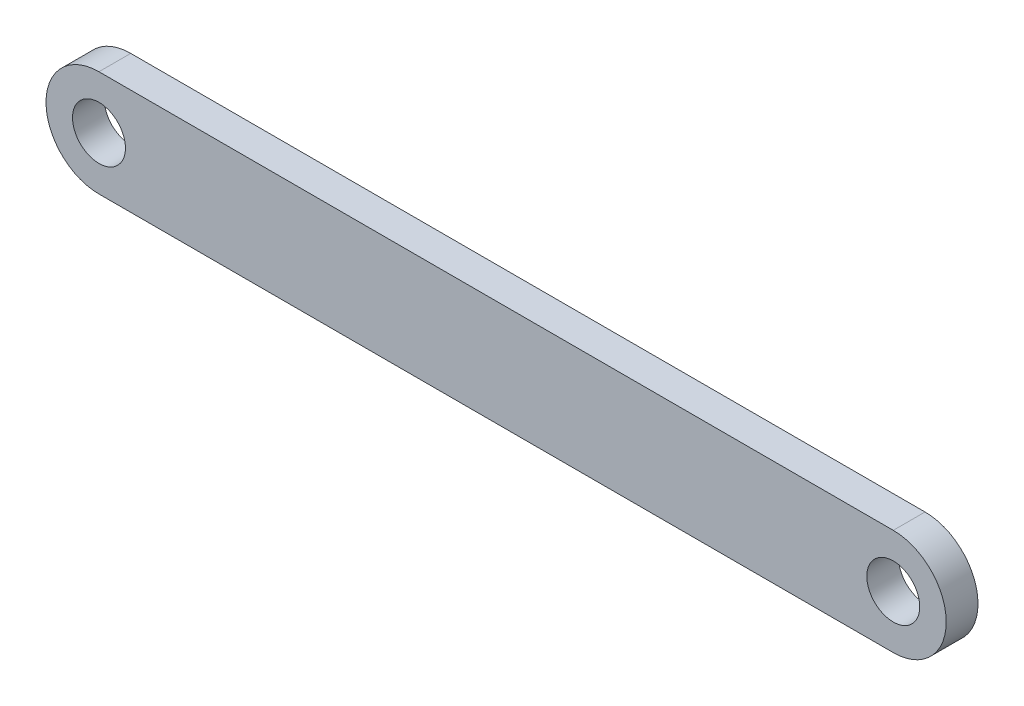
from build123d import *

# Parameters (mm, degrees)
SKETCH1_R           = 2.5
BOSS_EXTRUDE1_DEPTH = 3


with BuildPart() as part:
    # Sketch1 → Boss-Extrude1 (new body)
    with BuildSketch(Plane.XY):
        with BuildLine():
            Line((120.078651701, 190.032322866), (195.078651701, 190.032322866))
            ThreePointArc((195.078651701, 190.032322866), (200.078651701, 195.032322866), (195.078651701, 200.032322866))
            Line((195.078651701, 200.032322866), (120.078651701, 200.032322866))
            ThreePointArc((120.078651701, 200.032322866), (115.078651701, 195.032322866), (120.078651701, 190.032322866))
        make_face()
        with Locations((120.078651701, 195.032322866)):
            Circle(SKETCH1_R, mode=Mode.SUBTRACT)
        with Locations((195.078651701, 195.032322866)):
            Circle(SKETCH1_R, mode=Mode.SUBTRACT)
    extrude(amount=BOSS_EXTRUDE1_DEPTH)


solid = part.part
